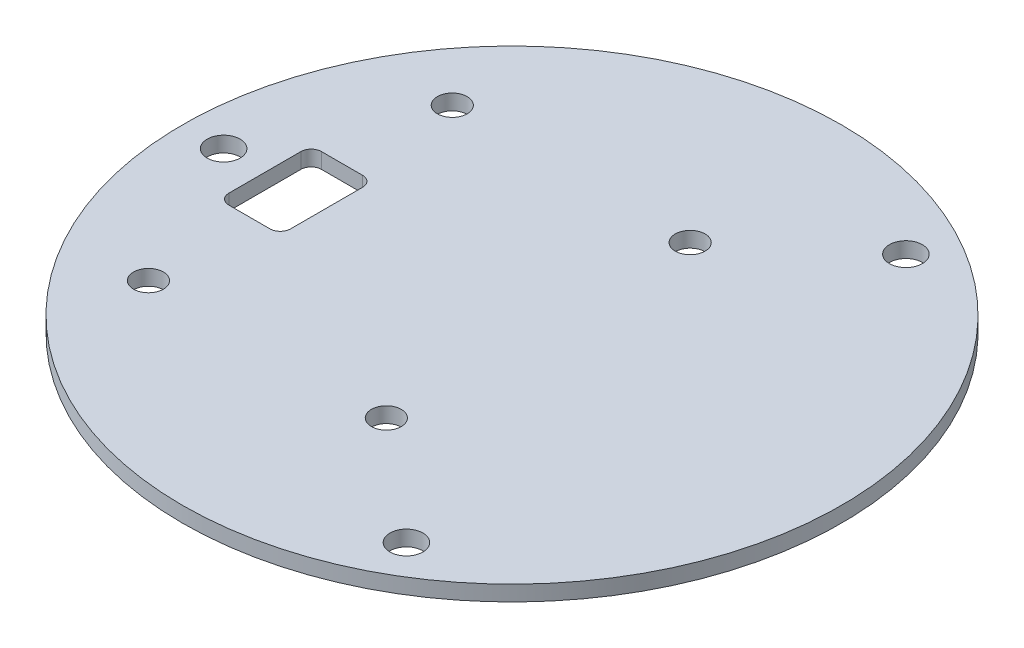
from build123d import *

# Parameters (mm, degrees)
SKETCH1_R          = 32
BASE_FLANGE1_DEPTH = 1.5
SKETCH6_R          = 1.6
CUT_EXTRUDE1_DEPTH = 46.279686395
SKETCH7_W          = 6
SKETCH7_H          = 9
CUT_EXTRUDE2_DEPTH = 46.279686395
FILLET1_R          = 1
SKETCH8_R          = 1.45
CUT_EXTRUDE3_DEPTH = 46.279686395


# Sheet-metal steps are written as plain solids
with BuildPart() as part:
    # Sketch1 → Base-Flange1 (new body)
    with BuildSketch(Plane(origin=(0, 0, 0), x_dir=(1, 0, 0), z_dir=(0, 1, 0))):
        with Locations(Location((0, 0, 0), (0, 0, 270))):
            Circle(SKETCH1_R)
    extrude(amount=-BASE_FLANGE1_DEPTH)

    # Sketch6 → Cut-Extrude1 (cut, through all)
    with BuildSketch(Plane(origin=(0, 0, 0), x_dir=(1, 0, 0), z_dir=(0, 1, 0))):
        with Locations(Location((-28, 0, 0), (0, 0, 270))):
            Circle(SKETCH6_R)
        with Locations(Location((14, 24.248711306, 0), (0, 0, 270))):
            Circle(SKETCH6_R)
        with Locations(Location((14, -24.248711306, 0), (0, 0, 270))):
            Circle(SKETCH6_R)
    extrude(amount=-CUT_EXTRUDE1_DEPTH, mode=Mode.SUBTRACT)

    # Sketch7 → Cut-Extrude2 (cut, through all)
    with BuildSketch(Plane(origin=(0, 0, 0), x_dir=(1, 0, 0), z_dir=(0, 1, 0))):
        with Locations((-21, 0)):
            Rectangle(SKETCH7_W, SKETCH7_H)
    extrude(amount=-CUT_EXTRUDE2_DEPTH, mode=Mode.SUBTRACT)

    # Fillet1
    fillet1_edges = [part.edges().sort_by_distance(p)[0] for p in [
        (-18, -0.75, -4.5),
        (-18, -0.75, 4.5),
        (-24, -0.75, 4.5),
        (-24, -0.75, -4.5),
    ]]
    fillet(fillet1_edges, radius=FILLET1_R)

    # Sketch8 → Cut-Extrude3 (cut, through all)
    with BuildSketch(Plane.XZ.offset(1.5)):
        with Locations(Location((2.55, -14.75, 0), (0, 0, 270))):
            Circle(SKETCH8_R)
        with Locations(Location((2.55, 14.75, 0), (0, 0, 270))):
            Circle(SKETCH8_R)
        with Locations(Location((-20.55, 14.75, 0), (0, 0, 270))):
            Circle(SKETCH8_R)
        with Locations(Location((-20.55, -14.75, 0), (0, 0, 270))):
            Circle(SKETCH8_R)
    extrude(amount=-CUT_EXTRUDE3_DEPTH, mode=Mode.SUBTRACT)


solid = part.part
